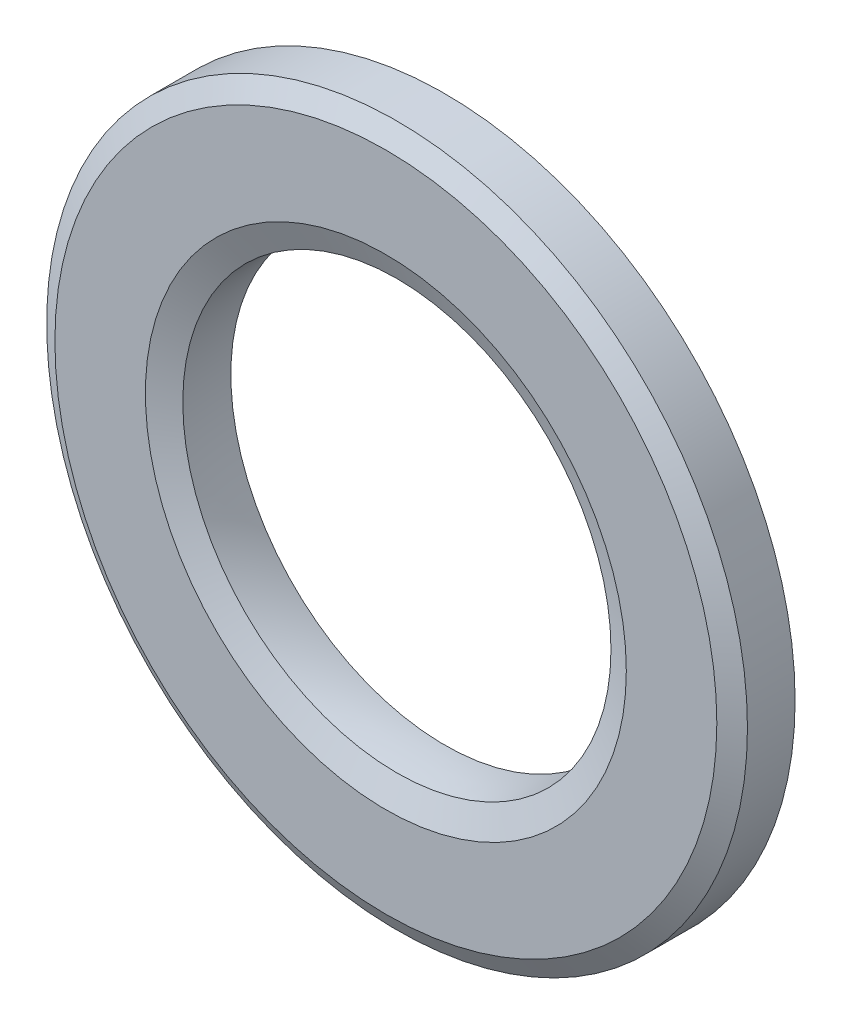
from build123d import *
from OCP.BRepFilletAPI import BRepFilletAPI_MakeChamfer

# Parameters (mm, degrees)
BOSS_EXTRUDE1_DEPTH      = 0.79375
BOSS_EXTRUDE1_DEPTH_BACK = 0.79375
SKETCH3_R                = 7.9375
SKETCH3_R_2              = 4.826
CHAMFER1_SIZE            = 0.254
CHAMFER1_SIZE2           = 0.439940905
CHAMFER2_SIZE            = 0.570578725


with BuildPart() as part:
    # Sketch3 → Boss-Extrude1 (new, two sides: drawn at the far end of the back side and taken through both)
    with BuildSketch(Plane.XY.offset(-BOSS_EXTRUDE1_DEPTH_BACK)):
        Circle(SKETCH3_R)
        Circle(SKETCH3_R_2, mode=Mode.SUBTRACT)
    extrude(amount=BOSS_EXTRUDE1_DEPTH + BOSS_EXTRUDE1_DEPTH_BACK)

    # Chamfer1: one chamfer whose edges measure the first distance from different faces: ONE call of the kernel's chamfer builder (chamfer() names one face for all edges)
    chamfer1_edges_1 = [part.edges().sort_by_distance(p)[0] for p in [
        (-7.9375, 0, 0.79375),
    ]]
    chamfer1_side_1 = [part.faces().sort_by_distance(p)[0] for p in [
        (-7.9375, 0, 0.396875),
    ]]
    chamfer1_edges_2 = [part.edges().sort_by_distance(p)[0] for p in [
        (-7.9375, 0, -0.79375),
    ]]
    chamfer1_side_2 = [part.faces().sort_by_distance(p)[0] for p in [
        (-7.9375, 0, -0.396875),
    ]]
    chamfer1 = BRepFilletAPI_MakeChamfer(part.part.solid().wrapped)
    for e in chamfer1_edges_1:
        chamfer1.Add(CHAMFER1_SIZE, CHAMFER1_SIZE2, e.wrapped, chamfer1_side_1[0].wrapped)  # the first distance lies on this face
    for e in chamfer1_edges_2:
        chamfer1.Add(CHAMFER1_SIZE, CHAMFER1_SIZE2, e.wrapped, chamfer1_side_2[0].wrapped)  # the first distance lies on this face
    add(Compound.cast(chamfer1.Shape()), mode=Mode.REPLACE)

    # Sketch4 → Cut-Revolve1 (revolve, cut)
    with BuildSketch(Plane(origin=(0, 0, 0), x_dir=(0, 0, -1), z_dir=(1, 0, 0)), mode=Mode.PRIVATE) as cut_revolve1_sk:
        with BuildLine():
            Line((-0.79375, 4.7752), (-0.79375, 4.8768))
            ThreePointArc((-0.79375, 4.8768), (0, 4.826), (0.79375, 4.8768))
            Line((0.79375, 4.8768), (0.79375, 4.7752))
            Line((0.79375, 4.7752), (-0.79375, 4.7752))
        make_face()
    revolve(cut_revolve1_sk.sketch.rotate(Axis((0, 0, 0.79375), (0, 0, -1)), 90), axis=Axis((0, 0, 0.79375), (0, 0, -1)), mode=Mode.SUBTRACT)

    # Chamfer2
    # the kernel refuses this chamfer: 0.570578725, 0.254 mm, written as the material it takes off along each edge
    with BuildSketch(Plane(origin=(0, 0, -0.79375), x_dir=(1, 0, 0), z_dir=(0, 1, 0))) as chamfer2_piece_1:
        with BuildLine():
            Line((4.8768 + CHAMFER2_SIZE, 0), (4.849816205, -0.249673341))
            ThreePointArc((4.849816205, -0.249673341), (4.86146095, -0.130166676), (4.8768, 0))
            Line((4.8768, 0), (4.8768 + CHAMFER2_SIZE, 0))
        make_face()
    revolve(axis=Axis((0, 0, -0.79375), (0, 0, -1)), mode=Mode.SUBTRACT)
    with BuildSketch(Plane(origin=(0, 0, 0.79375), x_dir=(1, 0, 0), z_dir=(0, 1, 0))) as chamfer2_piece_2:
        with BuildLine():
            Line((4.8768 + CHAMFER2_SIZE, 0), (4.849816205, 0.249673341))
            ThreePointArc((4.849816205, 0.249673341), (4.86146095, 0.130166676), (4.8768, 0))
            Line((4.8768, 0), (4.8768 + CHAMFER2_SIZE, 0))
        make_face()
    revolve(axis=Axis((0, 0, 0.79375), (0, 0, -1)), mode=Mode.SUBTRACT)


solid = part.part
